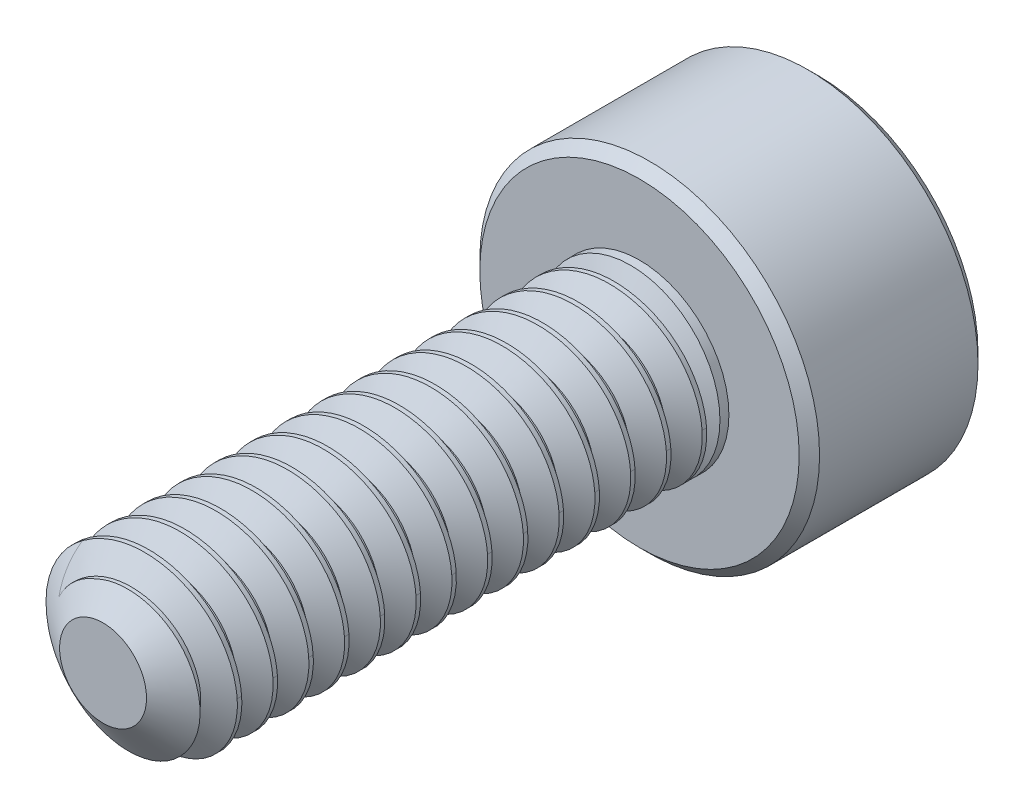
from build123d import *

# Parameters (mm, degrees)
SKETCH1_R          = 1
EXTRUDE1_DEPTH     = 6
CUT_SWEEP1_PITCH   = 0.4
SKETCH6_R          = 1.9
EXTRUDE2_DEPTH     = 2
CUT_EXTRUDE1_DEPTH = 1.125
CHAMFER1_SIZE      = 0.114


with BuildPart() as part:
    # Sketch1 → Extrude1 (new body)
    with BuildSketch(Plane.XY):
        Circle(SKETCH1_R)
    extrude(amount=-EXTRUDE1_DEPTH)

    # Cut-Sweep1: the profile of Sketch3 profile screwed along a right-hand helix of 16 turns, 6 arcs to a turn; built about Z, then put on its axis
    cut_sweep1_z = Axis((0, 0, 0), (0, 0, 1))
    cut_sweep1_corners = [(1.0003, 0, -0.350173205), (0.740192379, 0, -0.2), (0.740192379, 0, -0.15), (1.0003, 0, 0.000173205)]
    with BuildLine(mode=Mode.PRIVATE) as cut_sweep1_profile:
        Line(cut_sweep1_corners[0], cut_sweep1_corners[1])
        Line(cut_sweep1_corners[1], cut_sweep1_corners[2])
        Line(cut_sweep1_corners[2], cut_sweep1_corners[3])
        Line(cut_sweep1_corners[3], cut_sweep1_corners[0])
    cut_sweep1_cap = Face(cut_sweep1_profile.wire())
    cut_sweep1_turn_angles = [0, 30, 60, 90, 120, 150, 180, 210, 240, 270, 300, 330, 360]
    cut_sweep1_turn_weights = [1, 0.8660254037844387, 1, 0.8660254037844387, 1, 0.8660254037844387, 1, 0.8660254037844387, 1, 0.8660254037844387, 1, 0.8660254037844387, 1]
    cut_sweep1_turn_rails = [Edge.make_bspline([Vector(p[0], p[1], 0).rotate(cut_sweep1_z, cut_sweep1_turn_angles[k]) / cut_sweep1_turn_weights[k] + Vector(0, 0, p[2] + CUT_SWEEP1_PITCH * cut_sweep1_turn_angles[k] / 360) for k in range(13)], [0, 0, 0, 1, 1, 2, 2, 3, 3, 4, 4, 5, 5, 6, 6, 6], 2, cut_sweep1_turn_weights) for p in cut_sweep1_corners]
    cut_sweep1_turn_sides = [Face.make_surface_from_curves(cut_sweep1_turn_rails[p[0]], cut_sweep1_turn_rails[p[1]]) for p in [(0, 1), (1, 2), (2, 3), (3, 0)]]
    cut_sweep1 = Plane(origin=(0, 0, 0), x_dir=(0, 1, 0), z_dir=(0, 0, -1)) * Solid(Shell([*[p.moved(Location((0, 0, CUT_SWEEP1_PITCH * i))) for i in range(16) for p in cut_sweep1_turn_sides], cut_sweep1_cap, cut_sweep1_cap.rotate(cut_sweep1_z, 5760).moved(Location((0, 0, CUT_SWEEP1_PITCH * 5760 / 360)))]))
    add(cut_sweep1, mode=Mode.SUBTRACT)

    # Sketch4 → Cut-Revolve1 (revolve, cut)
    with BuildSketch(Plane(origin=(0, 0, 0), x_dir=(0, 0, -1), z_dir=(1, 0, 0)), mode=Mode.PRIVATE) as cut_revolve1_sk:
        Polygon((0.35977197, 1), (0, 0.486192379), (0, 1), align=None)
    revolve(cut_revolve1_sk.sketch.rotate(Axis((0, 0, 0), (0, 0, -1)), 278.428757719), axis=Axis((0, 0, 0), (0, 0, -1)), mode=Mode.SUBTRACT)

    # Sketch6 → Extrude2 (add)
    with BuildSketch(Plane(origin=(0, 0, -6), x_dir=(-1, 0, 0), z_dir=(0, 0, -1))):
        Circle(SKETCH6_R)
    extrude(amount=EXTRUDE2_DEPTH)

    # Sketch7 → Cut-Extrude1 (cut)
    with BuildSketch(Plane(origin=(0, 0, -8), x_dir=(-1, 0, 0), z_dir=(0, 0, -1))):
        Polygon((0, 0.866025404), (-0.75, 0.433012702), (-0.75, -0.433012702), (0, -0.866025404), (0.75, -0.433012702), (0.75, 0.433012702), align=None)
    extrude(amount=-CUT_EXTRUDE1_DEPTH, mode=Mode.SUBTRACT)

    # Cut-Extrude2 cone 1 section (through the dimple's axis) → Cut-Extrude2 (revolve, cut)
    with BuildSketch(Plane(origin=(0, 0, -8), x_dir=(0, 1, 0), z_dir=(1, 0, 0))):
        Polygon((0, 0), (0.866025404, 0), (0, 0.866025404), align=None)
    revolve(axis=Axis((0, 0, -8), (0, 0, 1)), mode=Mode.SUBTRACT)

    # Chamfer1
    chamfer1_edges = [part.edges().sort_by_distance(p)[0] for p in [
        (1.9, 0, -6),
        (1.9, 0, -8),
    ]]
    chamfer(chamfer1_edges, length=CHAMFER1_SIZE)

    # Sketch10 → Revolve1 (revolve)
    with BuildSketch(Plane(origin=(0, 0, 0), x_dir=(0, 0, -1), z_dir=(1, 0, 0)), mode=Mode.PRIVATE) as revolve1_sk:
        Polygon((6, 1), (6, 0), (5.485786438, 0), (5.9, 1), align=None)
    revolve(revolve1_sk.sketch.rotate(Axis((0, 0, -6), (0, 0, 1)), 270), axis=Axis((0, 0, -6), (0, 0, 1)))


solid = part.part
